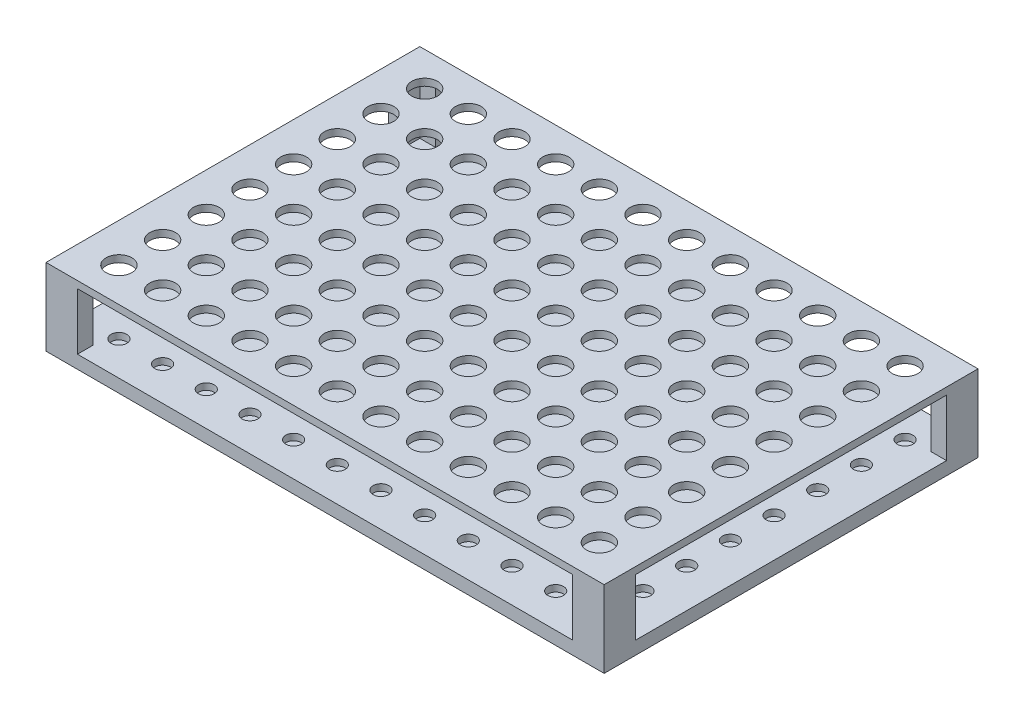
from build123d import *

# Parameters (mm, degrees)
SKETCH1_W           = 127.8
SKETCH1_H           = 85.6
BOSS_EXTRUDE1_DEPTH = 3
BOSS_EXTRUDE2_DEPTH = 13
SKETCH3_W           = 127.8
SKETCH3_H           = 85.6
BOSS_EXTRUDE3_DEPTH = 1.6
SKETCH6_R           = 2.95
CUT_EXTRUDE1_DEPTH  = 1.6
SKETCH8_R           = 1.8
CUT_EXTRUDE2_DEPTH  = 1.5


with BuildPart() as part:
    # Sketch1 → Boss-Extrude1 (new body)
    with BuildSketch(Plane(origin=(0, 0, 0), x_dir=(1, 0, 0), z_dir=(0, 1, 0))):
        Rectangle(SKETCH1_W, SKETCH1_H)
    extrude(amount=BOSS_EXTRUDE1_DEPTH)

    # Sketch2 → Boss-Extrude2 (add)
    with BuildSketch(Plane(origin=(0, 3, 0), x_dir=(1, 0, 0), z_dir=(0, 1, 0))):
        Polygon((-63.9, 42.8), (-56.7, 42.8), (-56.7, 39.2), (-60.3, 39.2), (-60.3, 35.6), (-63.9, 35.6), align=None)
        Polygon((63.9, 35.6), (63.9, 42.8), (56.7, 42.8), (56.7, 39.2), (60.3, 39.2), (60.3, 35.6), align=None)
        Polygon((63.9, -42.8), (56.7, -42.8), (56.7, -39.2), (60.3, -39.2), (60.3, -35.6), (63.9, -35.6), align=None)
        Polygon((-63.9, -35.6), (-63.9, -42.8), (-56.7, -42.8), (-56.7, -39.2), (-60.3, -39.2), (-60.3, -35.6), align=None)
    extrude(amount=BOSS_EXTRUDE2_DEPTH)

    # Sketch3 → Boss-Extrude3 (add)
    with BuildSketch(Plane(origin=(0, 16, 0), x_dir=(1, 0, 0), z_dir=(0, 1, 0))):
        Rectangle(SKETCH3_W, SKETCH3_H)
    extrude(amount=BOSS_EXTRUDE3_DEPTH)

    # Sketch6 → Cut-Extrude1 (cut)
    with BuildSketch(Plane(origin=(0, 17.6, 0), x_dir=(1, 0, 0), z_dir=(0, 1, 0))):
        with Locations((-55, 35)):
            Circle(SKETCH6_R)
        with Locations((-45, 35)):
            Circle(SKETCH6_R)
        with Locations((-35, 35)):
            Circle(SKETCH6_R)
        with Locations((-25, 35)):
            Circle(SKETCH6_R)
        with Locations((-15, 35)):
            Circle(SKETCH6_R)
        with Locations((-5, 35)):
            Circle(SKETCH6_R)
        with Locations((5, 35)):
            Circle(SKETCH6_R)
        with Locations((15, 35)):
            Circle(SKETCH6_R)
        with Locations((25, 35)):
            Circle(SKETCH6_R)
        with Locations((35, 35)):
            Circle(SKETCH6_R)
        with Locations((45, 35)):
            Circle(SKETCH6_R)
        with Locations((55, 35)):
            Circle(SKETCH6_R)
        with Locations((-55, 25)):
            Circle(SKETCH6_R)
        with Locations((-55, 15)):
            Circle(SKETCH6_R)
        with Locations((-55, 5)):
            Circle(SKETCH6_R)
        with Locations((-55, -5)):
            Circle(SKETCH6_R)
        with Locations((-55, -15)):
            Circle(SKETCH6_R)
        with Locations((-55, -25)):
            Circle(SKETCH6_R)
        with Locations((-55, -35)):
            Circle(SKETCH6_R)
        with Locations((-45, 25)):
            Circle(SKETCH6_R)
        with Locations((-45, 15)):
            Circle(SKETCH6_R)
        with Locations((-45, 5)):
            Circle(SKETCH6_R)
        with Locations((-45, -5)):
            Circle(SKETCH6_R)
        with Locations((-45, -15)):
            Circle(SKETCH6_R)
        with Locations((-45, -25)):
            Circle(SKETCH6_R)
        with Locations((-45, -35)):
            Circle(SKETCH6_R)
        with Locations((-35, 25)):
            Circle(SKETCH6_R)
        with Locations((-35, 15)):
            Circle(SKETCH6_R)
        with Locations((-35, 5)):
            Circle(SKETCH6_R)
        with Locations((-35, -5)):
            Circle(SKETCH6_R)
        with Locations((-35, -15)):
            Circle(SKETCH6_R)
        with Locations((-35, -25)):
            Circle(SKETCH6_R)
        with Locations((-35, -35)):
            Circle(SKETCH6_R)
        with Locations((-25, 25)):
            Circle(SKETCH6_R)
        with Locations((-25, 15)):
            Circle(SKETCH6_R)
        with Locations((-25, 5)):
            Circle(SKETCH6_R)
        with Locations((-25, -5)):
            Circle(SKETCH6_R)
        with Locations((-25, -15)):
            Circle(SKETCH6_R)
        with Locations((-25, -25)):
            Circle(SKETCH6_R)
        with Locations((-25, -35)):
            Circle(SKETCH6_R)
        with Locations((-15, 25)):
            Circle(SKETCH6_R)
        with Locations((-15, 15)):
            Circle(SKETCH6_R)
        with Locations((-15, 5)):
            Circle(SKETCH6_R)
        with Locations((-15, -5)):
            Circle(SKETCH6_R)
        with Locations((-15, -15)):
            Circle(SKETCH6_R)
        with Locations((-15, -25)):
            Circle(SKETCH6_R)
        with Locations((-15, -35)):
            Circle(SKETCH6_R)
        with Locations((-5, 25)):
            Circle(SKETCH6_R)
        with Locations((-5, 15)):
            Circle(SKETCH6_R)
        with Locations((-5, 5)):
            Circle(SKETCH6_R)
        with Locations((-5, -5)):
            Circle(SKETCH6_R)
        with Locations((-5, -15)):
            Circle(SKETCH6_R)
        with Locations((-5, -25)):
            Circle(SKETCH6_R)
        with Locations((-5, -35)):
            Circle(SKETCH6_R)
        with Locations((5, 25)):
            Circle(SKETCH6_R)
        with Locations((5, 15)):
            Circle(SKETCH6_R)
        with Locations((5, 5)):
            Circle(SKETCH6_R)
        with Locations((5, -5)):
            Circle(SKETCH6_R)
        with Locations((5, -15)):
            Circle(SKETCH6_R)
        with Locations((5, -25)):
            Circle(SKETCH6_R)
        with Locations((5, -35)):
            Circle(SKETCH6_R)
        with Locations((15, 25)):
            Circle(SKETCH6_R)
        with Locations((15, 15)):
            Circle(SKETCH6_R)
        with Locations((15, 5)):
            Circle(SKETCH6_R)
        with Locations((15, -5)):
            Circle(SKETCH6_R)
        with Locations((15, -15)):
            Circle(SKETCH6_R)
        with Locations((15, -25)):
            Circle(SKETCH6_R)
        with Locations((15, -35)):
            Circle(SKETCH6_R)
        with Locations((25, 25)):
            Circle(SKETCH6_R)
        with Locations((25, 15)):
            Circle(SKETCH6_R)
        with Locations((25, 5)):
            Circle(SKETCH6_R)
        with Locations((25, -5)):
            Circle(SKETCH6_R)
        with Locations((25, -15)):
            Circle(SKETCH6_R)
        with Locations((25, -25)):
            Circle(SKETCH6_R)
        with Locations((25, -35)):
            Circle(SKETCH6_R)
        with Locations((35, 25)):
            Circle(SKETCH6_R)
        with Locations((35, 15)):
            Circle(SKETCH6_R)
        with Locations((35, 5)):
            Circle(SKETCH6_R)
        with Locations((35, -5)):
            Circle(SKETCH6_R)
        with Locations((35, -15)):
            Circle(SKETCH6_R)
        with Locations((35, -25)):
            Circle(SKETCH6_R)
        with Locations((35, -35)):
            Circle(SKETCH6_R)
        with Locations((45, 25)):
            Circle(SKETCH6_R)
        with Locations((45, 15)):
            Circle(SKETCH6_R)
        with Locations((45, 5)):
            Circle(SKETCH6_R)
        with Locations((45, -5)):
            Circle(SKETCH6_R)
        with Locations((45, -15)):
            Circle(SKETCH6_R)
        with Locations((45, -25)):
            Circle(SKETCH6_R)
        with Locations((45, -35)):
            Circle(SKETCH6_R)
        with Locations((55, 25)):
            Circle(SKETCH6_R)
        with Locations((55, 15)):
            Circle(SKETCH6_R)
        with Locations((55, 5)):
            Circle(SKETCH6_R)
        with Locations((55, -5)):
            Circle(SKETCH6_R)
        with Locations((55, -15)):
            Circle(SKETCH6_R)
        with Locations((55, -25)):
            Circle(SKETCH6_R)
        with Locations((55, -35)):
            Circle(SKETCH6_R)
    extrude(amount=-CUT_EXTRUDE1_DEPTH, mode=Mode.SUBTRACT)

    # Sketch8 → Cut-Extrude2 (cut)
    with BuildSketch(Plane(origin=(0, 3, 0), x_dir=(1, 0, 0), z_dir=(0, 1, 0))):
        with Locations((-55, 35)):
            Circle(SKETCH8_R)
        with Locations((-45, 35)):
            Circle(SKETCH8_R)
        with Locations((-35, 35)):
            Circle(SKETCH8_R)
        with Locations((-25, 35)):
            Circle(SKETCH8_R)
        with Locations((-15, 35)):
            Circle(SKETCH8_R)
        with Locations((-5, 35)):
            Circle(SKETCH8_R)
        with Locations((5, 35)):
            Circle(SKETCH8_R)
        with Locations((15, 35)):
            Circle(SKETCH8_R)
        with Locations((25, 35)):
            Circle(SKETCH8_R)
        with Locations((35, 35)):
            Circle(SKETCH8_R)
        with Locations((45, 35)):
            Circle(SKETCH8_R)
        with Locations((55, 35)):
            Circle(SKETCH8_R)
        with Locations((-55, 25)):
            Circle(SKETCH8_R)
        with Locations((-55, 15)):
            Circle(SKETCH8_R)
        with Locations((-55, 5)):
            Circle(SKETCH8_R)
        with Locations((-55, -5)):
            Circle(SKETCH8_R)
        with Locations((-55, -15)):
            Circle(SKETCH8_R)
        with Locations((-55, -25)):
            Circle(SKETCH8_R)
        with Locations((-55, -35)):
            Circle(SKETCH8_R)
        with Locations((-45, 25)):
            Circle(SKETCH8_R)
        with Locations((-45, 15)):
            Circle(SKETCH8_R)
        with Locations((-45, 5)):
            Circle(SKETCH8_R)
        with Locations((-45, -5)):
            Circle(SKETCH8_R)
        with Locations((-45, -15)):
            Circle(SKETCH8_R)
        with Locations((-45, -25)):
            Circle(SKETCH8_R)
        with Locations((-45, -35)):
            Circle(SKETCH8_R)
        with Locations((-35, 25)):
            Circle(SKETCH8_R)
        with Locations((-35, 15)):
            Circle(SKETCH8_R)
        with Locations((-35, 5)):
            Circle(SKETCH8_R)
        with Locations((-35, -5)):
            Circle(SKETCH8_R)
        with Locations((-35, -15)):
            Circle(SKETCH8_R)
        with Locations((-35, -25)):
            Circle(SKETCH8_R)
        with Locations((-35, -35)):
            Circle(SKETCH8_R)
        with Locations((-25, 25)):
            Circle(SKETCH8_R)
        with Locations((-25, 15)):
            Circle(SKETCH8_R)
        with Locations((-25, 5)):
            Circle(SKETCH8_R)
        with Locations((-25, -5)):
            Circle(SKETCH8_R)
        with Locations((-25, -15)):
            Circle(SKETCH8_R)
        with Locations((-25, -25)):
            Circle(SKETCH8_R)
        with Locations((-25, -35)):
            Circle(SKETCH8_R)
        with Locations((-15, 25)):
            Circle(SKETCH8_R)
        with Locations((-15, 15)):
            Circle(SKETCH8_R)
        with Locations((-15, 5)):
            Circle(SKETCH8_R)
        with Locations((-15, -5)):
            Circle(SKETCH8_R)
        with Locations((-15, -15)):
            Circle(SKETCH8_R)
        with Locations((-15, -25)):
            Circle(SKETCH8_R)
        with Locations((-15, -35)):
            Circle(SKETCH8_R)
        with Locations((-5, 25)):
            Circle(SKETCH8_R)
        with Locations((-5, 15)):
            Circle(SKETCH8_R)
        with Locations((-5, 5)):
            Circle(SKETCH8_R)
        with Locations((-5, -5)):
            Circle(SKETCH8_R)
        with Locations((-5, -15)):
            Circle(SKETCH8_R)
        with Locations((-5, -25)):
            Circle(SKETCH8_R)
        with Locations((-5, -35)):
            Circle(SKETCH8_R)
        with Locations((5, 25)):
            Circle(SKETCH8_R)
        with Locations((5, 15)):
            Circle(SKETCH8_R)
        with Locations((5, 5)):
            Circle(SKETCH8_R)
        with Locations((5, -5)):
            Circle(SKETCH8_R)
        with Locations((5, -15)):
            Circle(SKETCH8_R)
        with Locations((5, -25)):
            Circle(SKETCH8_R)
        with Locations((5, -35)):
            Circle(SKETCH8_R)
        with Locations((15, 25)):
            Circle(SKETCH8_R)
        with Locations((15, 15)):
            Circle(SKETCH8_R)
        with Locations((15, 5)):
            Circle(SKETCH8_R)
        with Locations((15, -5)):
            Circle(SKETCH8_R)
        with Locations((15, -15)):
            Circle(SKETCH8_R)
        with Locations((15, -25)):
            Circle(SKETCH8_R)
        with Locations((15, -35)):
            Circle(SKETCH8_R)
        with Locations((25, 25)):
            Circle(SKETCH8_R)
        with Locations((25, 15)):
            Circle(SKETCH8_R)
        with Locations((25, 5)):
            Circle(SKETCH8_R)
        with Locations((25, -5)):
            Circle(SKETCH8_R)
        with Locations((25, -15)):
            Circle(SKETCH8_R)
        with Locations((25, -25)):
            Circle(SKETCH8_R)
        with Locations((25, -35)):
            Circle(SKETCH8_R)
        with Locations((35, 25)):
            Circle(SKETCH8_R)
        with Locations((35, 15)):
            Circle(SKETCH8_R)
        with Locations((35, 5)):
            Circle(SKETCH8_R)
        with Locations((35, -5)):
            Circle(SKETCH8_R)
        with Locations((35, -15)):
            Circle(SKETCH8_R)
        with Locations((35, -25)):
            Circle(SKETCH8_R)
        with Locations((35, -35)):
            Circle(SKETCH8_R)
        with Locations((45, 25)):
            Circle(SKETCH8_R)
        with Locations((45, 15)):
            Circle(SKETCH8_R)
        with Locations((45, 5)):
            Circle(SKETCH8_R)
        with Locations((45, -5)):
            Circle(SKETCH8_R)
        with Locations((45, -15)):
            Circle(SKETCH8_R)
        with Locations((45, -25)):
            Circle(SKETCH8_R)
        with Locations((45, -35)):
            Circle(SKETCH8_R)
        with Locations((55, 25)):
            Circle(SKETCH8_R)
        with Locations((55, 15)):
            Circle(SKETCH8_R)
        with Locations((55, 5)):
            Circle(SKETCH8_R)
        with Locations((55, -5)):
            Circle(SKETCH8_R)
        with Locations((55, -15)):
            Circle(SKETCH8_R)
        with Locations((55, -25)):
            Circle(SKETCH8_R)
        with Locations((55, -35)):
            Circle(SKETCH8_R)
    extrude(amount=-CUT_EXTRUDE2_DEPTH, mode=Mode.SUBTRACT)


solid = part.part
